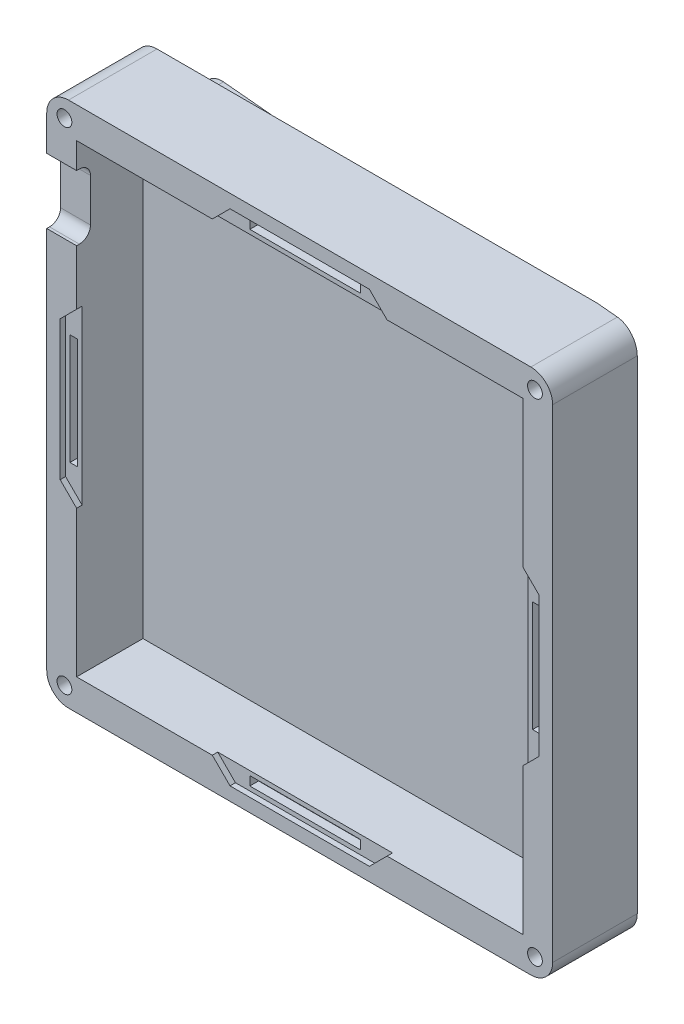
from build123d import *

# Parameters (mm, degrees)
SKETCH1_W                                  = 120.9294
SKETCH1_H                                  = 116.1796
BOSS_EXTRUDE1_DEPTH                        = 5.08
SKETCH2_W                                  = 116.1796
SKETCH2_H                                  = 120.9294
SKETCH2_W_2                                = 102.459137156
SKETCH2_H_2                                = 106.648
BOSS_EXTRUDE2_DEPTH                        = 15.24
CUT_EXTRUDE1_DEPTH                         = 1.25
SKETCH4_W                                  = 25.4
SKETCH4_H                                  = 2.0635
SKETCH4_W_2                                = 1.783031422
SKETCH4_H_2                                = 25.4
CUT_EXTRUDE2_DEPTH                         = 2
CUT_EXTRUDE3_DEPTH                         = 9.906
SKETCH7_R                                  = 3
CUT_EXTRUDE4_DEPTH                         = 12.32
SKETCH8_R                                  = 1.7
CUT_EXTRUDE5_DEPTH                         = 12.32
MIRROR1_AT_THE_SECOND_PLANE_COPY_1_SKETC_R = 3
MIRROR1_AT_THE_SECOND_PLANE_COPY_1_DEPTH   = 12.32
MIRROR1_AT_THE_SECOND_PLANE_COPY_2_SKETC_R = 1.7
MIRROR1_AT_THE_SECOND_PLANE_COPY_2_DEPTH   = 12.32
SKETCH6_W                                  = 109.22
SKETCH6_H                                  = 106.6546
BOSS_EXTRUDE3_DEPTH                        = 9.5504
FILLET1_R                                  = 5.08
FILLET2_R                                  = 5
CUT_EXTRUDE6_DEPTH                         = 18.034
CUT_EXTRUDE6_DEPTH_BACK                    = 130.048


with BuildPart() as part:
    # Sketch1 → Boss-Extrude1 (new body)
    with BuildSketch(Plane(origin=(0, 0, 0), x_dir=(0, 1, 0), z_dir=(0, 0, 1))):
        Rectangle(SKETCH1_W, SKETCH1_H)
    extrude(amount=BOSS_EXTRUDE1_DEPTH)

    # Sketch2 → Boss-Extrude2 (add)
    with BuildSketch(Plane.XY.offset(5.08)):
        Rectangle(SKETCH2_W, SKETCH2_H)
        Rectangle(SKETCH2_W_2, SKETCH2_H_2, mode=Mode.SUBTRACT)
    extrude(amount=BOSS_EXTRUDE2_DEPTH)

    # Sketch3 → Cut-Extrude1 (cut)
    with BuildSketch(Plane.XY.offset(20.32)):
        Polygon((-50.0126, -52.3875), (-21, -52.3875), (-16, -57.3875), (16, -57.3875), (21, -52.3875), (50.0126, -52.3875), (50.0126, -21), (55.0126, -16), (55.0126, 16), (50.0126, 21), (50.0126, 52.3875), (21, 52.3875), (16, 57.3875), (-16, 57.3875), (-21, 52.3875), (-50.0126, 52.3875), (-50.0126, 21), (-55.0126, 16), (-55.0126, -16), (-50.0126, -21), align=None)
    extrude(amount=-CUT_EXTRUDE1_DEPTH, mode=Mode.SUBTRACT)

    # Sketch4 → Cut-Extrude2 (cut)
    with BuildSketch(Plane.XY.offset(19.07)):
        with Locations((0, 55.35575)):
            Rectangle(SKETCH4_W, SKETCH4_H)
        with Locations((0, -55.35575)):
            Rectangle(SKETCH4_W, SKETCH4_H)
        with Locations((-53.121084289, 0)):
            Rectangle(SKETCH4_W_2, SKETCH4_H_2)
        with Locations((53.121084289, 0)):
            Rectangle(SKETCH4_W_2, SKETCH4_H_2)
    extrude(amount=-CUT_EXTRUDE2_DEPTH, mode=Mode.SUBTRACT)

    # Sketch5 → Cut-Extrude3 (cut)
    with BuildSketch(Plane(origin=(-58.0898, 0, 0), x_dir=(0, -1, 0), z_dir=(-1, 0, 0))):
        with BuildLine():
            Line((-44.8211, 26.3172), (-34.9603, 26.3172))
            ThreePointArc((-34.9603, 26.3172), (-33.164248776, 25.573251224), (-32.4203, 23.7772))
            Line((-32.4203, 23.7772), (-32.4203, 19.6822))
            ThreePointArc((-32.4203, 19.6822), (-33.164248776, 17.886148776), (-34.9603, 17.1422))
            Line((-34.9603, 17.1422), (-44.8211, 17.1422))
            ThreePointArc((-44.8211, 17.1422), (-46.617151224, 17.886148776), (-47.3611, 19.6822))
            Line((-47.3611, 19.6822), (-47.3611, 23.7772))
            ThreePointArc((-47.3611, 23.7772), (-46.617151224, 25.573251224), (-44.8211, 26.3172))
        make_face()
    extrude(amount=-CUT_EXTRUDE3_DEPTH, mode=Mode.SUBTRACT)

    # Sketch7 → Cut-Extrude4 (cut)
    with BuildSketch(Plane(origin=(0, 0, 0), x_dir=(1, 0, 0), z_dir=(0, 0, -1))):
        with Locations((-54.0258, 56.4007)):
            Circle(SKETCH7_R)
    cut_extrude4 = extrude(amount=-CUT_EXTRUDE4_DEPTH, mode=Mode.SUBTRACT)

    # Sketch8 → Cut-Extrude5 (cut)
    with BuildSketch(Plane(origin=(0, 0, 12.32), x_dir=(1, 0, 0), z_dir=(0, 0, -1))):
        with Locations((-54.0258, 56.4007)):
            Circle(SKETCH8_R)
    cut_extrude5 = extrude(amount=-CUT_EXTRUDE5_DEPTH, mode=Mode.SUBTRACT)

    # Mirror1: Cut-Extrude4, Cut-Extrude5 across plane
    add(cut_extrude4.mirror(Plane.ZX), mode=Mode.SUBTRACT)
    add(cut_extrude5.mirror(Plane.ZX), mode=Mode.SUBTRACT)

    # Mirror1 at the second plane: Cut-Extrude4, Cut-Extrude5 across plane
    add(cut_extrude4.mirror(Plane(origin=(0, 0, 0), x_dir=(0, 0, 1), z_dir=(1, 0, 0))), mode=Mode.SUBTRACT)
    add(cut_extrude5.mirror(Plane(origin=(0, 0, 0), x_dir=(0, 0, 1), z_dir=(1, 0, 0))), mode=Mode.SUBTRACT)

    # Mirror1 at the second plane copy 1 sketc → Mirror1 at the second plane copy 1 (cut)
    with BuildSketch(Plane(origin=(0, 0, 0), x_dir=(-1, 0, 0), z_dir=(0, 0, -1))):
        with Locations((-54.0258, 56.4007)):
            Circle(MIRROR1_AT_THE_SECOND_PLANE_COPY_1_SKETC_R)
    extrude(amount=-MIRROR1_AT_THE_SECOND_PLANE_COPY_1_DEPTH, mode=Mode.SUBTRACT)

    # Mirror1 at the second plane copy 2 sketc → Mirror1 at the second plane copy 2 (cut)
    with BuildSketch(Plane(origin=(0, 0, 12.32), x_dir=(-1, 0, 0), z_dir=(0, 0, -1))):
        with Locations((-54.0258, 56.4007)):
            Circle(MIRROR1_AT_THE_SECOND_PLANE_COPY_2_SKETC_R)
    extrude(amount=-MIRROR1_AT_THE_SECOND_PLANE_COPY_2_DEPTH, mode=Mode.SUBTRACT)

    # Sketch6 → Boss-Extrude3 (add)
    with BuildSketch(Plane(origin=(0, 0, 0), x_dir=(1, 0, 0), z_dir=(0, 0, -1))):
        with Locations((3.4798, 0)):
            Rectangle(SKETCH6_W, SKETCH6_H)
    extrude(amount=BOSS_EXTRUDE3_DEPTH)

    # Fillet1
    fillet1_edges = [part.edges().sort_by_distance(p)[0] for p in [
        (-51.1302, 53.3273, -4.7752),
        (-51.1302, -53.3273, -4.7752),
    ]]
    fillet(fillet1_edges, radius=FILLET1_R)

    # Fillet2
    fillet2_edges = [part.edges().sort_by_distance(p)[0] for p in [
        (-58.0898, 60.4647, 10.16),
        (-58.0898, -60.4647, 10.16),
        (58.0898, -60.4647, 10.16),
        (58.0898, 60.4647, 10.16),
    ]]
    fillet(fillet2_edges, radius=FILLET2_R)

    # Sketch10 → Cut-Extrude6 (cut, two sides: drawn at the far end of the back side and taken through both)
    with BuildSketch(Plane(origin=(0, 53.3273, 0), x_dir=(-1, 0, 0), z_dir=(0, 1, 0)).offset(-CUT_EXTRUDE6_DEPTH_BACK)):
        Polygon((-58.0898, 0.888884821), (51.1302, -8.666627009), (51.1302, -9.5504), (-58.0898, -9.5504), align=None)
    extrude(amount=CUT_EXTRUDE6_DEPTH + CUT_EXTRUDE6_DEPTH_BACK, mode=Mode.SUBTRACT)


solid = part.part
